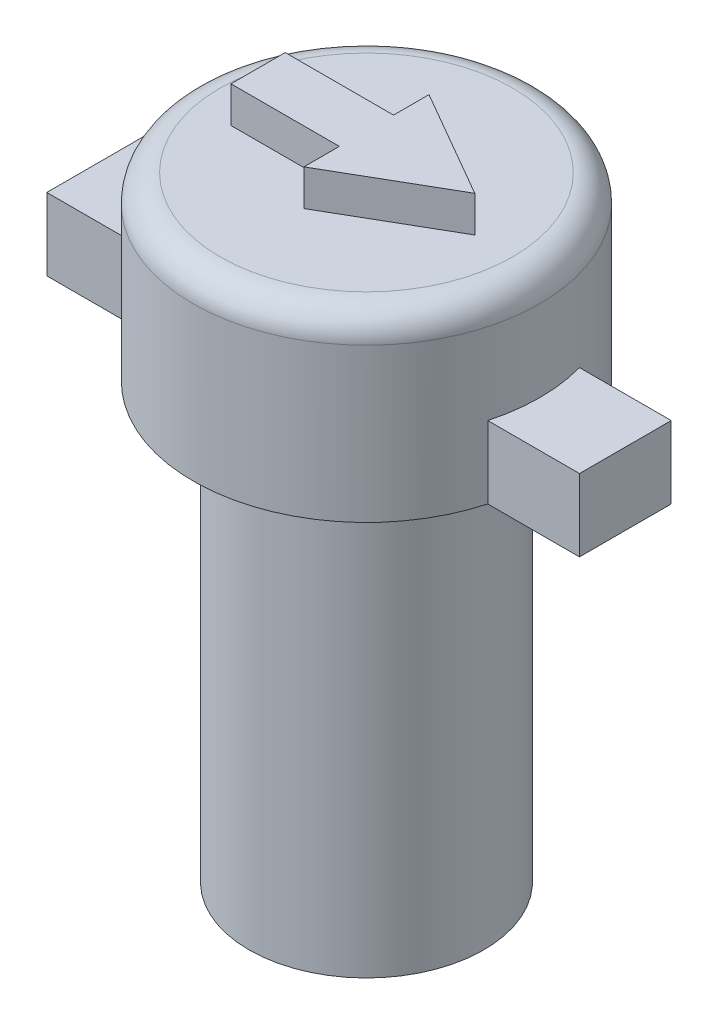
from build123d import *

# Parameters (mm, degrees)
SKETCH1_R           = 3.25
BOSS_EXTRUDE1_DEPTH = 12.018
SKETCH6_R           = 4.8
BOSS_EXTRUDE2_DEPTH = 5
FILLET1_R           = 0.75
BOSS_EXTRUDE3_DEPTH = 1
BOSS_EXTRUDE4_DEPTH = 2


with BuildPart() as part:
    # Sketch1 → Boss-Extrude1 (new body)
    with BuildSketch(Plane(origin=(0, 0, 0), x_dir=(1, 0, 0), z_dir=(0, 1, 0))):
        Circle(SKETCH1_R)
    extrude(amount=BOSS_EXTRUDE1_DEPTH)

    # Sketch6 → Boss-Extrude2 (add)
    with BuildSketch(Plane(origin=(0, 12.018, 0), x_dir=(1, 0, 0), z_dir=(0, 1, 0))):
        Circle(SKETCH6_R)
    extrude(amount=BOSS_EXTRUDE2_DEPTH)

    # Fillet1
    fillet1_edges = [part.edges().sort_by_distance(p)[0] for p in [
        (-4.8, 17.018, 0),
    ]]
    fillet(fillet1_edges, radius=FILLET1_R)

    # Sketch8 → Boss-Extrude3 (add)
    with BuildSketch(Plane(origin=(0, 17.018, 0), x_dir=(1, 0, 0), z_dir=(0, 1, 0))):
        Polygon((0, 0.75), (-3, 0.75), (-3, -0.75), (0, -0.75), (0, -1.732050808), (3, 0), (0, 1.732050808), align=None)
    extrude(amount=BOSS_EXTRUDE3_DEPTH)

    # Sketch9 → Boss-Extrude4 (add)
    with BuildSketch(Plane.XZ.offset(-12.018)):
        with BuildLine():
            Line((-4.405788806, 1.905), (-6.945788806, 1.905))
            Line((-6.945788806, 1.905), (-6.945788806, -1.905))
            Line((-6.945788806, -1.905), (-4.405788806, -1.905))
            ThreePointArc((-4.405788806, -1.905), (-4.8, 0), (-4.405788806, 1.905))
        make_face()
        with BuildLine():
            Line((4.628941564, 1.27), (7.168941564, 1.27))
            Line((7.168941564, 1.27), (7.168941564, -1.27))
            Line((7.168941564, -1.27), (4.628941564, -1.27))
            ThreePointArc((4.628941564, -1.27), (4.8, 0), (4.628941564, 1.27))
        make_face()
    extrude(amount=-BOSS_EXTRUDE4_DEPTH)


solid = part.part
